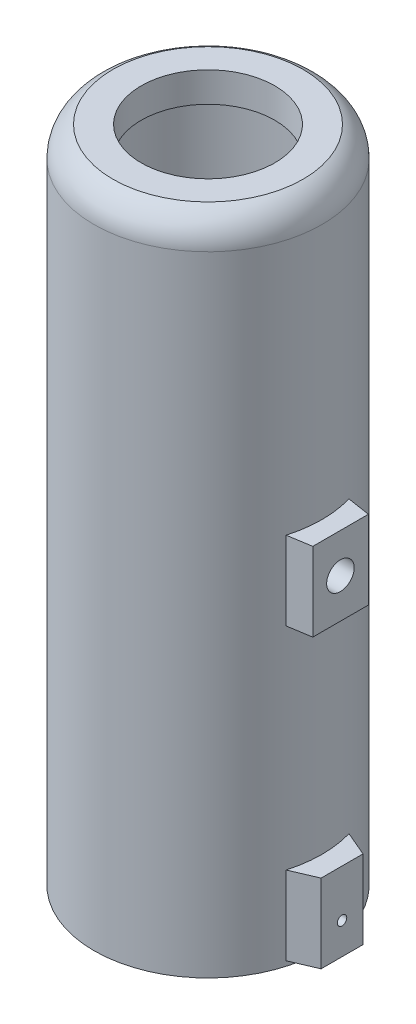
from build123d import *

# Parameters (mm, degrees)
BOSS_EXTRUDE1_REACH        = 91.067
BOSS_EXTRUDE1_START_RADIUS = 14.5
BOSS_EXTRUDE1_END_RADIUS   = 14.5
SKETCH5_W                  = 8
SKETCH5_H                  = 10
CUT_EXTRUDE1_START         = -10
CUT_EXTRUDE1_DEPTH         = 10
SKETCH8_R                  = 1.75
CUT_EXTRUDE2_DEPTH         = 3
CUT_EXTRUDE3_START         = -3
SKETCH9_R                  = 1.75
CUT_EXTRUDE3_DEPTH         = 3
CUT_EXTRUDE5_DEPTH         = 10
CUT_EXTRUDE8_START         = -10
CUT_EXTRUDE8_DEPTH         = 10
SKETCH13_R                 = 0.6
CUT_EXTRUDE9_DEPTH         = 3


# Read off the part's stored shape, not the designer's step: Cut-Extrude1, Cut-Extrude8
with BuildPart() as part:
    # Sketch1 → Revolve1 (revolve)
    with BuildSketch(Plane.XY, mode=Mode.PRIVATE) as revolve1_sk:
        with BuildLine():
            Line((12, 0), (14.5, 0))
            Line((14.5, 0), (14.5, 80))
            ThreePointArc((14.5, 80), (13.849763488, 82.244753612), (12.100400466, 83.794416583))
            Line((12.100400466, 83.794416583), (8.5, 83.794416583))
            Line((8.5, 83.794416583), (8.5, 80))
            Line((8.5, 80), (12, 80))
            Line((12, 80), (12, 0))
        make_face()
    revolve(revolve1_sk.sketch.rotate(Axis((0, 0, 0), (0, 1, 0)), 90), axis=Axis((0, 0, 0), (0, 1, 0)))

    # Boss-Extrude1: from a cylinder face, 91.067 long prism both ways, kept between that surface and its translate by the depth
    boss_extrude1_start = Plane(origin=(0, 24.058844, 0), z_dir=(0, -1, 0)) * Cylinder(BOSS_EXTRUDE1_START_RADIUS, 249.016312, mode=Mode.PRIVATE)
    boss_extrude1_end = Plane(origin=(2.8, 24.058844, 0), z_dir=(0, -1, 0)) * Cylinder(BOSS_EXTRUDE1_END_RADIUS, 249.016312, mode=Mode.PRIVATE)
    # Sketch5 → Boss-Extrude1 (add, from a surface)
    with BuildSketch(Plane(origin=(0, 0, 0), x_dir=(0, 0, -1), z_dir=(1, 0, 0)), mode=Mode.PRIVATE) as boss_extrude1_sk1:
        with Locations((-0.003167699, 5.61768818)):
            Rectangle(SKETCH5_W, SKETCH5_H)
    boss_extrude1_tool1 = extrude(boss_extrude1_sk1.sketch, amount=BOSS_EXTRUDE1_REACH, both=True, mode=Mode.PRIVATE)
    # Sketch5 → Boss-Extrude1 (add, from a surface)
    with BuildSketch(Plane(origin=(0, 0, 0), x_dir=(0, 0, -1), z_dir=(1, 0, 0)), mode=Mode.PRIVATE) as boss_extrude1_sk2:
        with Locations((0, 42.5)):
            Rectangle(SKETCH5_W, SKETCH5_H)
    boss_extrude1_tool2 = extrude(boss_extrude1_sk2.sketch, amount=BOSS_EXTRUDE1_REACH, both=True, mode=Mode.PRIVATE)
    boss_extrude1 = ((boss_extrude1_tool1 - boss_extrude1_start) & boss_extrude1_end).solids().sort_by_distance((15.337359, 5.617688, 0.003168))[0] + ((boss_extrude1_tool2 - boss_extrude1_start) & boss_extrude1_end).solids().sort_by_distance((15.337359, 5.617688, 0.003168))[0]
    add(boss_extrude1)

    # Cut-Extrude1 outline → Cut-Extrude1 (cut)
    with BuildSketch(Plane(origin=(0, 47.5, 0), x_dir=(1, 0, 0), z_dir=(0, 1, 0)).offset(CUT_EXTRUDE1_START)):
        with BuildLine():
            Line((16.737359865, 4), (13.937359865, 4))
            Line((13.937359865, 4), (16.863384202, 3.531462132))
            ThreePointArc((16.863384202, 3.531462132), (16.802331913, 3.766258222), (16.737359865, 4))
        make_face()
        with BuildLine():
            ThreePointArc((16.737359865, -4), (16.802331913, -3.766258222), (16.863384202, -3.531462132))
            Line((16.863384202, -3.531462132), (13.937359865, -4))
            Line((13.937359865, -4), (16.737359865, -4))
        make_face()
        with BuildLine():
            ThreePointArc((16.863384202, -3.531462132), (17.3, 0), (16.863384202, 3.531462132))
            Line((16.863384202, 3.531462132), (16.863384202, -3.531462132))
        make_face()
    cut_extrude1 = extrude(amount=CUT_EXTRUDE1_DEPTH, mode=Mode.SUBTRACT)

    # Mirror2: Boss-Extrude1, Cut-Extrude1 across plane
    add(boss_extrude1.mirror(Plane(origin=(0, 0, 0), x_dir=(0, 0, 1), z_dir=(1, 0, 0))))
    add(cut_extrude1.mirror(Plane(origin=(0, 0, 0), x_dir=(0, 0, 1), z_dir=(1, 0, 0))), mode=Mode.SUBTRACT)

    # Sketch8 → Cut-Extrude2 (cut)
    with BuildSketch(Plane.ZY.offset(16.863384202)):
        with Locations((0.02126458, 42.512867657)):
            Circle(SKETCH8_R)
    extrude(amount=-CUT_EXTRUDE2_DEPTH, mode=Mode.SUBTRACT)

    # Sketch9 → Cut-Extrude3 (cut)
    with BuildSketch(Plane(origin=(16.863384202, 0, 0), x_dir=(0, 0, -1), z_dir=(1, 0, 0)).offset(CUT_EXTRUDE3_START)):
        with Locations(Location((-0.02126458, 42.512867657, 0), (0, 0, 180))):
            Circle(SKETCH9_R)
    extrude(amount=CUT_EXTRUDE3_DEPTH, mode=Mode.SUBTRACT)

    # Sketch11 → Cut-Extrude5 (cut)
    with BuildSketch(Plane(origin=(0, 10.61768818, 0), x_dir=(1, 0, 0), z_dir=(0, 1, 0))):
        with BuildLine():
            Line((-13.9382686, 3.996832301), (-16.7382686, 3.996832301))
            ThreePointArc((-16.7382686, 3.996832301), (-17.299999625, -0.003295577), (-16.73645035, -4.003167699))
            Line((-16.73645035, -4.003167699), (-13.93645035, -4.003167699))
            ThreePointArc((-13.93645035, -4.003167699), (-14.499999625, -0.003295577), (-13.9382686, 3.996832301))
        make_face()
    extrude(amount=-CUT_EXTRUDE5_DEPTH, mode=Mode.SUBTRACT)

    # Cut-Extrude8 outline → Cut-Extrude8 (cut)
    with BuildSketch(Plane(origin=(0, 10.61768818, 0), x_dir=(1, 0, 0), z_dir=(0, 1, 0)).offset(CUT_EXTRUDE8_START)):
        with BuildLine():
            Line((16.7382686, 3.996832301), (13.9382686, 3.996832301))
            Line((13.9382686, 3.996832301), (17.052533954, 2.667447447))
            ThreePointArc((17.052533954, 2.667447447), (16.91106492, 3.335842745), (16.7382686, 3.996832301))
        make_face()
        with BuildLine():
            ThreePointArc((16.73645035, -4.003167699), (16.910306381, -3.339049838), (17.052533954, -2.667447447))
            Line((17.052533954, -2.667447447), (13.93645035, -4.003167699))
            Line((13.93645035, -4.003167699), (16.73645035, -4.003167699))
        make_face()
        with BuildLine():
            ThreePointArc((17.052533954, -2.667447447), (17.3, 0), (17.052533954, 2.667447447))
            Line((17.052533954, 2.667447447), (17.052533954, -2.667447447))
        make_face()
    extrude(amount=CUT_EXTRUDE8_DEPTH, mode=Mode.SUBTRACT)

    # Sketch13 → Cut-Extrude9 (cut)
    with BuildSketch(Plane(origin=(17.052533954, 0, 0), x_dir=(0, 0, -1), z_dir=(1, 0, 0))):
        with Locations((0, 4.61768818)):
            Circle(SKETCH13_R)
    extrude(amount=-CUT_EXTRUDE9_DEPTH, mode=Mode.SUBTRACT)


solid = part.part
